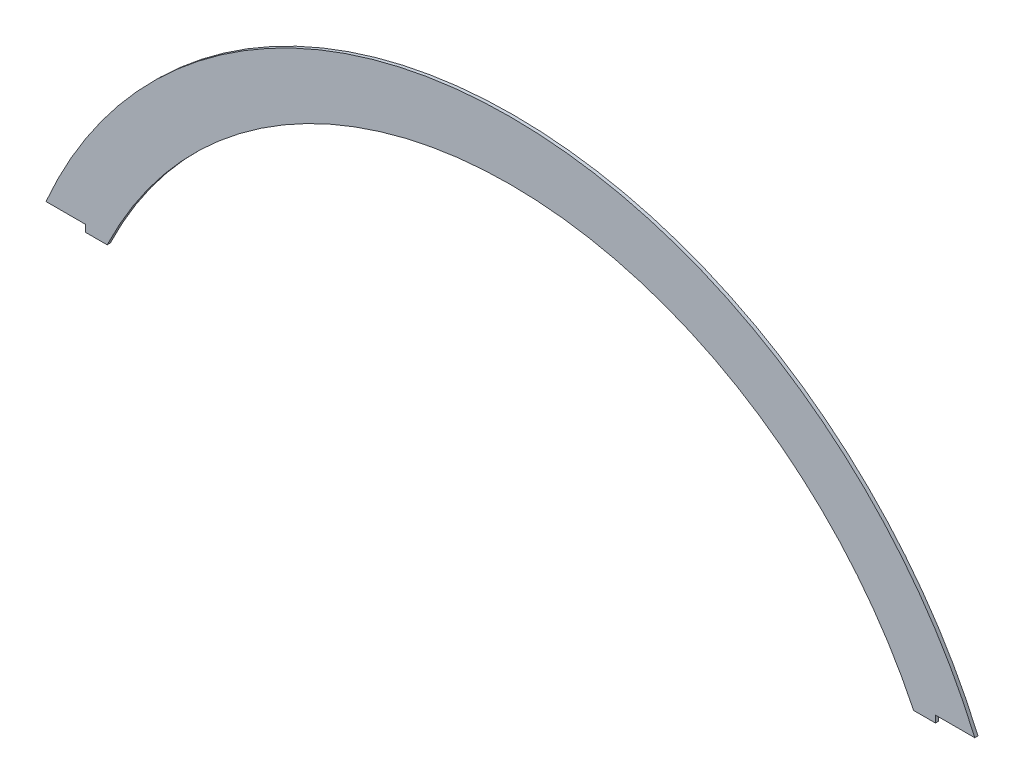
from build123d import *

# Parameters (mm, degrees)
SKETCH1_R          = 950
SKETCH1_R_2        = 840
BASE_FLANGE1_DEPTH = 6
SKETCH6_W          = 2732.981099596
SKETCH6_H          = 1353.854573776
CUT_EXTRUDE1_DEPTH = 10
SKETCH8_W          = 79.396529378
SKETCH8_H          = 13
CUT_EXTRUDE2_DEPTH = 10


# Sheet-metal steps are written as plain solids
with BuildPart() as part:
    # Sketch1 → Base-Flange1 (new body)
    with BuildSketch(Plane.XY):
        Circle(SKETCH1_R)
        Circle(SKETCH1_R_2, mode=Mode.SUBTRACT)
    extrude(amount=-BASE_FLANGE1_DEPTH)

    # Sketch6 → Cut-Extrude1 (cut)
    with BuildSketch(Plane.XY):
        with Locations((-160.657409421, -313.927286888)):
            Rectangle(SKETCH6_W, SKETCH6_H)
    extrude(amount=-CUT_EXTRUDE1_DEPTH, mode=Mode.SUBTRACT)

    # Sketch8 → Cut-Extrude2 (cut)
    with BuildSketch(Plane.XY):
        with Locations((-838.214601147, 369.5)):
            Rectangle(SKETCH8_W, SKETCH8_H)
    cut_extrude2 = extrude(amount=-CUT_EXTRUDE2_DEPTH, mode=Mode.SUBTRACT)

    # Mirror1: Cut-Extrude2 across plane
    add(cut_extrude2.mirror(Plane(origin=(0, 0, 0), x_dir=(0, 0, 1), z_dir=(1, 0, 0))), mode=Mode.SUBTRACT)


solid = part.part
